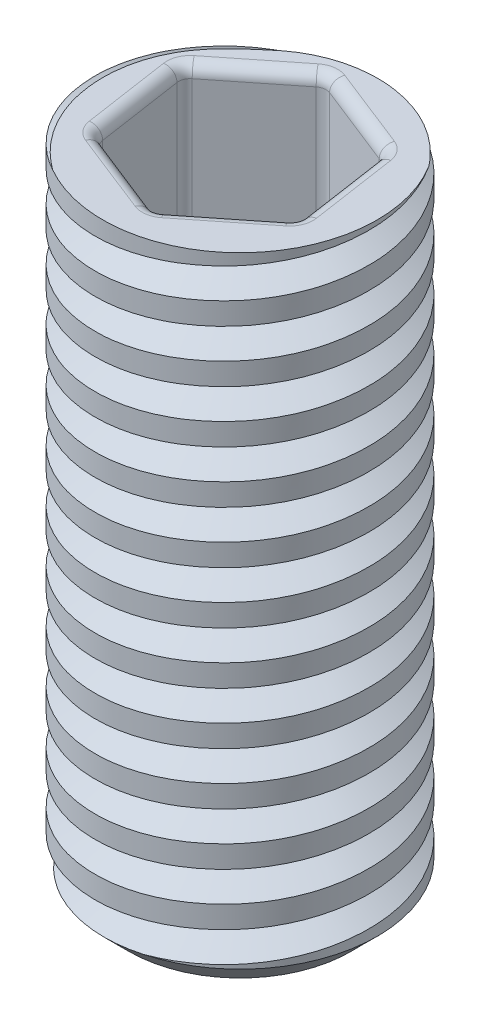
from build123d import *

# Parameters (mm, degrees)
ESBO_O1_R                       = 2.1
RESSALTO_EXTRUS_O1_DEPTH        = 9.9
CHANFRO1_SIZE                   = 0.4
VARREDURA_DE_CORTE1_PITCH       = 0.8
VARREDURA_DE_CORTE1_HEIGHT      = 10.4
VARREDURA_DE_CORTE1_RADIUS      = 2.1
VARREDURA_DE_CORTE1_START_ANGLE = 90
CORTE_EXTRUS_O4_DEPTH           = 3.5
FILETE3_R                       = 0.18
ESBO_O11_R                      = 1.24
CORTE_EXTRUS_O5_DEPTH           = 0.55
CORTE_EXTRUS_O5_DRAFT           = -45
FILETE4_R                       = 0.18


with BuildPart() as part:
    # Esboço1 → Ressalto-extrusão1 (new body)
    with BuildSketch(Plane(origin=(0, 0, 0), x_dir=(1, 0, 0), z_dir=(0, 1, 0))):
        with Locations(Location((0, 0, 0), (0, 0, 90))):
            Circle(ESBO_O1_R)
    extrude(amount=RESSALTO_EXTRUS_O1_DEPTH)

    # Chanfro1
    chanfro1_edges = [part.edges().sort_by_distance(p)[0] for p in [
        (0, 0, 2.1),
    ]]
    chamfer(chanfro1_edges, length=CHANFRO1_SIZE)

    # Varredura de corte1: sweep along a helix
    with BuildLine() as varredura_de_corte1_path:
        add(Helix(VARREDURA_DE_CORTE1_PITCH, VARREDURA_DE_CORTE1_HEIGHT, VARREDURA_DE_CORTE1_RADIUS, center=(0, 0, 0), direction=(0, 1, 0), mode=Mode.PRIVATE).rotate(Axis((0, 0, 0), (0, 1, 0)), VARREDURA_DE_CORTE1_START_ANGLE))
    # Esboço9 → Varredura de corte1 (sweep, cut)
    with BuildSketch(Plane.XY):
        with BuildLine():
            Line((2.305411157, 0.34322916), (1.730317345, 0.023124323))
            ThreePointArc((1.730317345, 0.023124323), (1.720046787, 0.005962865), (1.729773766, -0.011512428))
            Line((1.729773766, -0.011512428), (2.294539594, -0.34950586))
            Line((2.294539594, -0.34950586), (2.305411157, 0.34322916))
        make_face()
    sweep(path=varredura_de_corte1_path.line, is_frenet=True, mode=Mode.SUBTRACT)

    # Esboço10 → Corte-extrusão4 (cut)
    with BuildSketch(Plane(origin=(0, 9.9, 0), x_dir=(1, 0, 0), z_dir=(0, 1, 0))):
        Polygon((1.220727336, 0.969445599), (-0.229200848, 1.541903684), (-1.449928185, 0.572458085), (-1.220727336, -0.969445599), (0.229200848, -1.541903684), (1.449928185, -0.572458085), align=None)
    extrude(amount=-CORTE_EXTRUS_O4_DEPTH, mode=Mode.SUBTRACT)

    # Filete3
    filete3_edges = [part.edges().sort_by_distance(p)[0] for p in [
        (-1.449928185, 8.15, -0.572458085),
        (-0.229200848, 8.15, -1.541903684),
        (1.220727336, 8.15, -0.969445599),
        (1.449928185, 8.15, 0.572458085),
        (0.229200848, 8.15, 1.541903684),
        (-1.220727336, 8.15, 0.969445599),
        (-0.839564517, 9.9, -1.057180884),
        (-1.335327761, 9.9, 0.198493757),
        (-0.495763244, 9.9, 1.255674642),
        (0.839564517, 9.9, 1.057180884),
        (1.335327761, 9.9, -0.198493757),
        (0.495763244, 9.9, -1.255674642),
    ]]
    fillet(filete3_edges, radius=FILETE3_R)


with BuildPart() as corte_extrus_o5_tool:
    # Esboço11 → Corte-extrusão5 (with draft: the straight prism first)
    with BuildSketch(Plane.XZ):
        Circle(ESBO_O11_R)
    extrude(amount=-CORTE_EXTRUS_O5_DEPTH)
    # Corte-extrusão5: the draft: its side faces are tilted about the plane it starts from
    corte_extrus_o5_sides = [corte_extrus_o5_tool.faces().sort_by_distance(p)[0] for p in [
        (-1.24, 0.275, 0),
    ]]
    draft(corte_extrus_o5_sides, Plane.XZ, CORTE_EXTRUS_O5_DRAFT)


with BuildPart() as part_1:
    add(part.part)

    # Corte-extrusão5: cut by corte_extrus_o5_tool
    add(corte_extrus_o5_tool.part, mode=Mode.SUBTRACT)

    # Filete4
    filete4_edges = [part_1.edges().sort_by_distance(p)[0] for p in [
        (-0.69, 0.55, 0),
        (-1.24, 0, 0),
    ]]
    fillet(filete4_edges, radius=FILETE4_R)


solid = part_1.part
